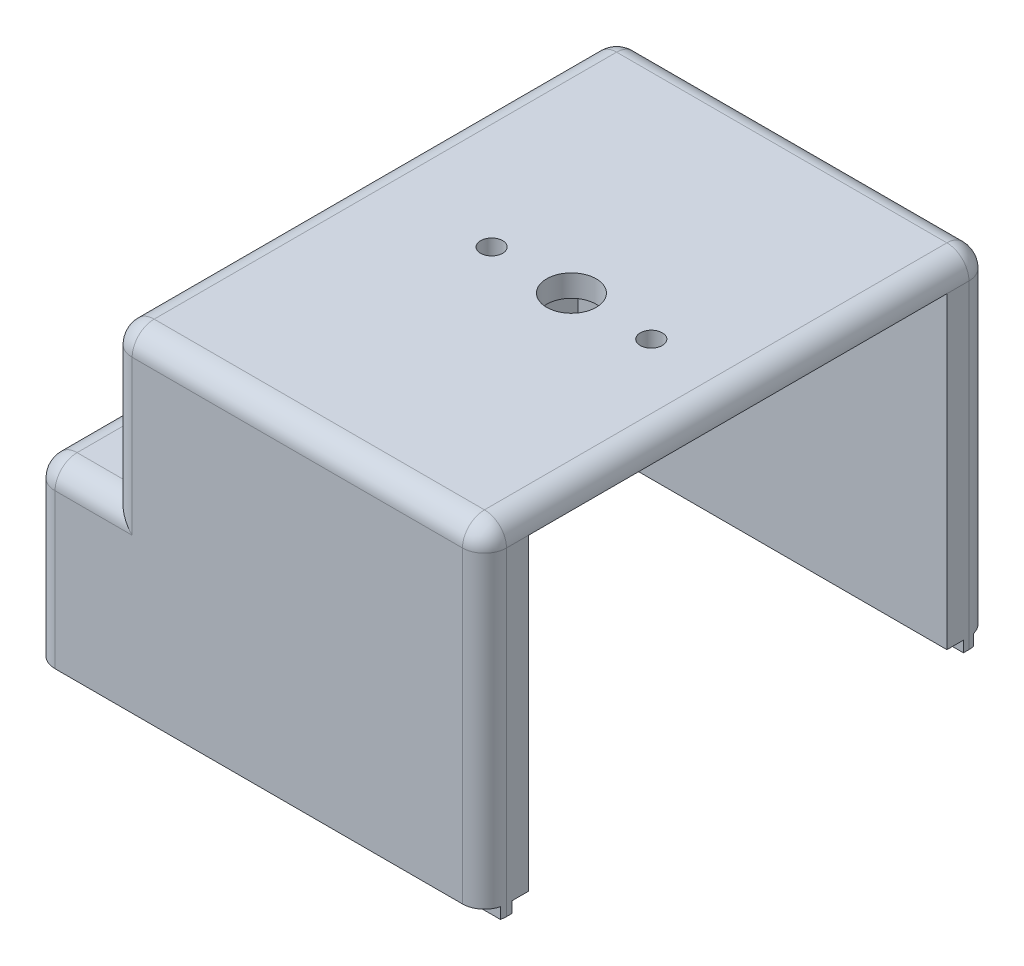
from build123d import *

# Parameters (mm, degrees)
ESQUISSE1_W                  = 41
ESQUISSE1_H                  = 46
ESQUISSE1_R                  = 2.25
ESQUISSE1_R_2                = 1
BOSS_EXTRU_1_DEPTH           = 30
ENL_V_START                  = 30
ESQUISSE2_W                  = 7
ESQUISSE2_H                  = 46
ENL_V_MAT_EXTRU_1_DEPTH      = 14
ENL_V_MAT_EXTRU_3_DEPTH      = 28.002906878
ENL_V_MAT_EXTRU_3_DEPTH_BACK = 44.002906878
ENL_V_MAT_EXTRU_3_START      = 16
ESQUISSE2_3_R                = 3
ESQUISSE3_W                  = 33.5
ESQUISSE3_H                  = 38
ENL_V_MAT_EXTRU_4_DEPTH      = 28
ESQUISSE4_W                  = 30
ESQUISSE4_H                  = 0.997507574
BOSS_EXTRU_2_DEPTH           = 1
CONG_1_R                     = 2
CONG_2_R                     = 2


# Some blends are built 0.0001 mm under size
with BuildPart() as part:
    # Esquisse1 → Boss.-Extru.1 (new body)
    with BuildSketch(Plane(origin=(0, 0, 0), x_dir=(1, 0, 0), z_dir=(0, 1, 0))):
        Rectangle(ESQUISSE1_W, ESQUISSE1_H)
        with Locations(Location((5.4, 0, 0), (0, 0, 270))):
            Circle(ESQUISSE1_R, mode=Mode.SUBTRACT)
        with Locations(Location((-1.85, 0, 0), (0, 0, 270))):
            Circle(ESQUISSE1_R_2, mode=Mode.SUBTRACT)
        with Locations(Location((12.65, 0, 0), (0, 0, 270))):
            Circle(ESQUISSE1_R_2, mode=Mode.SUBTRACT)
    extrude(amount=BOSS_EXTRU_1_DEPTH)

    # Esquisse2 → Enlèv. mat.-Extru.1 (cut)
    with BuildSketch(Plane(origin=(0, 0, 0), x_dir=(1, 0, 0), z_dir=(0, 1, 0)).offset(ENL_V_START)):
        with Locations((-17, 0)):
            Rectangle(ESQUISSE2_W, ESQUISSE2_H)
    extrude(amount=-ENL_V_MAT_EXTRU_1_DEPTH, mode=Mode.SUBTRACT)

    # Esquisse2<3> → Enlèv. mat.-Extru.3 (cut, two sides: drawn at the far end of the back side and taken through both)
    with BuildSketch(Plane(origin=(0, 0, 0), x_dir=(1, 0, 0), z_dir=(0, 1, 0)).offset(ENL_V_MAT_EXTRU_3_START - ENL_V_MAT_EXTRU_3_DEPTH_BACK)):
        with Locations(Location((-17, -8.75, 0), (0, 0, 90))):
            Circle(ESQUISSE2_3_R)
        with Locations(Location((-17, 8.75, 0), (0, 0, 90))):
            Circle(ESQUISSE2_3_R)
    extrude(amount=ENL_V_MAT_EXTRU_3_DEPTH + ENL_V_MAT_EXTRU_3_DEPTH_BACK, mode=Mode.SUBTRACT)

    # Esquisse3 → Enlèv. mat.-Extru.4 (cut)
    with BuildSketch(Plane(origin=(0, 0, 0), x_dir=(1, 0, 0), z_dir=(0, 1, 0))):
        with Locations((3.75, 0)):
            Rectangle(ESQUISSE3_W, ESQUISSE3_H)
    extrude(amount=ENL_V_MAT_EXTRU_4_DEPTH, mode=Mode.SUBTRACT)

    # Esquisse4 → Boss.-Extru.2 (add)
    with BuildSketch(Plane(origin=(0, 0, 0), x_dir=(1, 0, 0), z_dir=(0, 1, 0))):
        with Locations((5.5, -21)):
            Rectangle(ESQUISSE4_W, ESQUISSE4_H)
        with Locations((5.5, 21)):
            Rectangle(ESQUISSE4_W, ESQUISSE4_H)
    extrude(amount=-BOSS_EXTRU_2_DEPTH)

    # Congé1
    # the kernel refuses this fillet: 2 mm, written as the material it takes off along each edge
    with BuildSketch(Plane(origin=(-11.5, 28, -21), x_dir=(-1, 0, 0), z_dir=(0, 0, -1))) as cong_1_piece_1_section:
        Polygon((0, 0), (CONG_1_R, 0), (CONG_1_R, CONG_1_R), (0, CONG_1_R), align=None)
    cong_1_piece_1 = extrude(amount=CONG_1_R, mode=Mode.PRIVATE)
    cong_1_piece_1 = cong_1_piece_1 - Plane(origin=(-11.5, 28, -21), x_dir=(0.7071067811865475, -0.7071067811865475, 0), z_dir=(0, 0, -1)) * Sphere(CONG_1_R, mode=Mode.PRIVATE)
    add(cong_1_piece_1, mode=Mode.SUBTRACT)
    with BuildSketch(Plane(origin=(-18.5, 14, -21), x_dir=(0, 1, 0), z_dir=(-1, 0, 0))) as cong_1_piece_2_section:
        Polygon((0, 0), (CONG_1_R, 0), (CONG_1_R, CONG_1_R), (0, CONG_1_R), align=None)
    cong_1_piece_2 = extrude(amount=CONG_1_R, mode=Mode.PRIVATE)
    cong_1_piece_2 = cong_1_piece_2 - Plane(origin=(-18.5, 14, -21), x_dir=(0, -0.7071067811865475, 0.7071067811865475), z_dir=(-1, 0, 0)) * Sphere(CONG_1_R, mode=Mode.PRIVATE)
    add(cong_1_piece_2, mode=Mode.SUBTRACT)
    with BuildSketch(Plane(origin=(-11.5, 28, 21), x_dir=(-1, 0, 0), z_dir=(0, 0, 1))) as cong_1_piece_3_section:
        Polygon((0, 0), (CONG_1_R, 0), (CONG_1_R, -CONG_1_R), (0, -CONG_1_R), align=None)
    cong_1_piece_3 = extrude(amount=CONG_1_R, mode=Mode.PRIVATE)
    cong_1_piece_3 = cong_1_piece_3 - Plane(origin=(-11.5, 28, 21), x_dir=(0.7071067811865475, -0.7071067811865475, 0), z_dir=(0, 0, 1)) * Sphere(CONG_1_R, mode=Mode.PRIVATE)
    add(cong_1_piece_3, mode=Mode.SUBTRACT)
    with BuildSketch(Plane(origin=(-18.5, 14, 21), x_dir=(-1, 0, 0), z_dir=(0, 0, 1))) as cong_1_piece_4_section:
        Polygon((0, 0), (CONG_1_R, 0), (CONG_1_R, -CONG_1_R), (0, -CONG_1_R), align=None)
    cong_1_piece_4 = extrude(amount=CONG_1_R, mode=Mode.PRIVATE)
    cong_1_piece_4 = cong_1_piece_4 - Plane(origin=(-18.5, 14, 21), x_dir=(0.7071067811865475, -0.7071067811865475, 0), z_dir=(0, 0, 1)) * Sphere(CONG_1_R, mode=Mode.PRIVATE)
    add(cong_1_piece_4, mode=Mode.SUBTRACT)
    with BuildSketch(Plane(origin=(-11.5, 30, -23), x_dir=(0, 0, 1), z_dir=(1, 0, 0))) as cong_1_piece_5:
        with BuildLine():
            CenterArc((CONG_1_R, CONG_1_R), CONG_1_R, 180, 90)
            Line((0, CONG_1_R), (0, 0))
            Line((0, 0), (CONG_1_R, 0))
        make_face()
    extrude(amount=37, mode=Mode.SUBTRACT)
    with BuildSketch(Plane(origin=(-20.5, -5, -23), x_dir=(0, 0, 1), z_dir=(0, 1, 0)), Plane(origin=(-20.5, -5, 23), x_dir=(1, 0, 0), z_dir=(0, 1, 0))) as cong_1_piece_6:
        with BuildLine():
            CenterArc((CONG_1_R, CONG_1_R), CONG_1_R, 180, 90)
            Line((0, CONG_1_R), (0, 0))
            Line((0, 0), (CONG_1_R, 0))
        make_face()
    extrude(amount=19, mode=Mode.SUBTRACT)
    with BuildSketch(Plane(origin=(25.5, 30, 23), x_dir=(0, -1, 0), z_dir=(-1, 0, 0))) as cong_1_piece_7:
        with BuildLine():
            CenterArc((CONG_1_R, -CONG_1_R), CONG_1_R, 90, 90)
            Line((0, -CONG_1_R), (0, 0))
            Line((0, 0), (CONG_1_R, 0))
        make_face()
    extrude(amount=37, mode=Mode.SUBTRACT)
    with BuildSketch(Plane(origin=(-13.5, 16, 23), x_dir=(0, -1, 0), z_dir=(-1, 0, 0))) as cong_1_piece_8:
        with BuildLine():
            CenterArc((CONG_1_R, -CONG_1_R), CONG_1_R, 90, 90)
            Line((0, -CONG_1_R), (0, 0))
            Line((0, 0), (CONG_1_R, 0))
        make_face()
    extrude(amount=5, mode=Mode.SUBTRACT)
    with BuildSketch(Plane(origin=(-13.5, 28, 23), x_dir=(1, 0, 0), z_dir=(0, -1, 0)), Plane(origin=(-13.5, 28, -23), x_dir=(0, 0, 1), z_dir=(0, -1, 0))) as cong_1_piece_9:
        with BuildLine():
            CenterArc((CONG_1_R, -CONG_1_R), CONG_1_R, 90, 90)
            Line((0, -CONG_1_R), (0, 0))
            Line((0, 0), (CONG_1_R, 0))
        make_face()
    extrude(amount=12, mode=Mode.SUBTRACT)
    with BuildSketch(Plane(origin=(-20.5, 16, 21), x_dir=(0, -1, 0), z_dir=(0, 0, -1))) as cong_1_piece_10:
        with BuildLine():
            CenterArc((CONG_1_R, -CONG_1_R), CONG_1_R, 90, 90)
            Line((0, -CONG_1_R), (0, 0))
            Line((0, 0), (CONG_1_R, 0))
        make_face()
    extrude(amount=42, mode=Mode.SUBTRACT)
    with BuildSketch(Plane(origin=(-13.5, 30, -21), x_dir=(0, -1, 0), z_dir=(0, 0, 1))) as cong_1_piece_11:
        with BuildLine():
            CenterArc((CONG_1_R, CONG_1_R), CONG_1_R, 180, 90)
            Line((0, CONG_1_R), (0, 0))
            Line((0, 0), (CONG_1_R, 0))
        make_face()
    extrude(amount=42, mode=Mode.SUBTRACT)
    with BuildSketch(Plane(origin=(-18.5, 16, -23), x_dir=(0, 0, 1), z_dir=(1, 0, 0))) as cong_1_piece_12:
        with BuildLine():
            CenterArc((CONG_1_R, CONG_1_R), CONG_1_R, 180, 90)
            Line((0, CONG_1_R), (0, 0))
            Line((0, 0), (CONG_1_R, 0))
        make_face()
    extrude(amount=5, mode=Mode.SUBTRACT)
    with BuildSketch(Plane(origin=(-8.5, 16, 23), x_dir=(0, -1, 0), z_dir=(-1, 0, 0))) as cong_1_piece_13a_section:
        with BuildLine():
            CenterArc((CONG_1_R, -CONG_1_R), CONG_1_R, 90, 90)
            Line((0, -CONG_1_R), (0, 0))
            Line((0, 0), (CONG_1_R, 0))
        make_face()
    cong_1_piece_13a = extrude(amount=10, mode=Mode.PRIVATE)
    cong_1_piece_13a = split(cong_1_piece_13a, bisect_by=Plane(origin=(-13.5, 15.547209771, 22.547209771), z_dir=(1, 0, 0)), keep=Keep.TOP, mode=Mode.PRIVATE)
    with BuildSketch(Plane(origin=(-13.5, 28, 23), x_dir=(1, 0, 0), z_dir=(0, -1, 0))) as cong_1_piece_13b_section:
        with BuildLine():
            CenterArc((CONG_1_R, -CONG_1_R), CONG_1_R, 90, 90)
            Line((0, -CONG_1_R), (0, 0))
            Line((0, 0), (CONG_1_R, 0))
        make_face()
    cong_1_piece_13b = extrude(amount=17, mode=Mode.PRIVATE)
    cong_1_piece_13b = split(cong_1_piece_13b, bisect_by=Plane(origin=(-13.047209771, 16, 22.547209771), z_dir=(0, -1, 0)), keep=Keep.TOP, mode=Mode.PRIVATE)
    cong_1_piece_13 = cong_1_piece_13a & cong_1_piece_13b
    add(cong_1_piece_13, mode=Mode.SUBTRACT)
    with BuildSketch(Plane(origin=(-18.5, 16, -23), x_dir=(0, 0, 1), z_dir=(1, 0, 0))) as cong_1_piece_14a_section:
        with BuildLine():
            CenterArc((CONG_1_R, CONG_1_R), CONG_1_R, 180, 90)
            Line((0, CONG_1_R), (0, 0))
            Line((0, 0), (CONG_1_R, 0))
        make_face()
    cong_1_piece_14a = extrude(amount=10, mode=Mode.PRIVATE)
    cong_1_piece_14a = split(cong_1_piece_14a, bisect_by=Plane(origin=(-13.5, 15.547209771, -22.547209771), z_dir=(1, 0, 0)), keep=Keep.TOP, mode=Mode.PRIVATE)
    with BuildSketch(Plane(origin=(-13.5, 28, -23), x_dir=(0, 0, 1), z_dir=(0, -1, 0))) as cong_1_piece_14b_section:
        with BuildLine():
            CenterArc((CONG_1_R, -CONG_1_R), CONG_1_R, 90, 90)
            Line((0, -CONG_1_R), (0, 0))
            Line((0, 0), (CONG_1_R, 0))
        make_face()
    cong_1_piece_14b = extrude(amount=17, mode=Mode.PRIVATE)
    cong_1_piece_14b = split(cong_1_piece_14b, bisect_by=Plane(origin=(-13.047209771, 16, -22.547209771), z_dir=(0, -1, 0)), keep=Keep.TOP, mode=Mode.PRIVATE)
    cong_1_piece_14 = cong_1_piece_14a & cong_1_piece_14b
    add(cong_1_piece_14, mode=Mode.SUBTRACT)

    # Congé2
    cong_2_edges = [part.edges().sort_by_distance(p)[0] for p in [
        (20.5, 14, 23),
        (20.5, 29.414213562, 22.414213562),
        (20.5, 14, -23),
        (20.5, 29.414213562, -22.414213562),
        (20.5, 30, 0),
    ]]
    fillet(cong_2_edges, radius=CONG_2_R - 0.0001)  # a hair under: the kernel refuses the full size


solid = part.part
